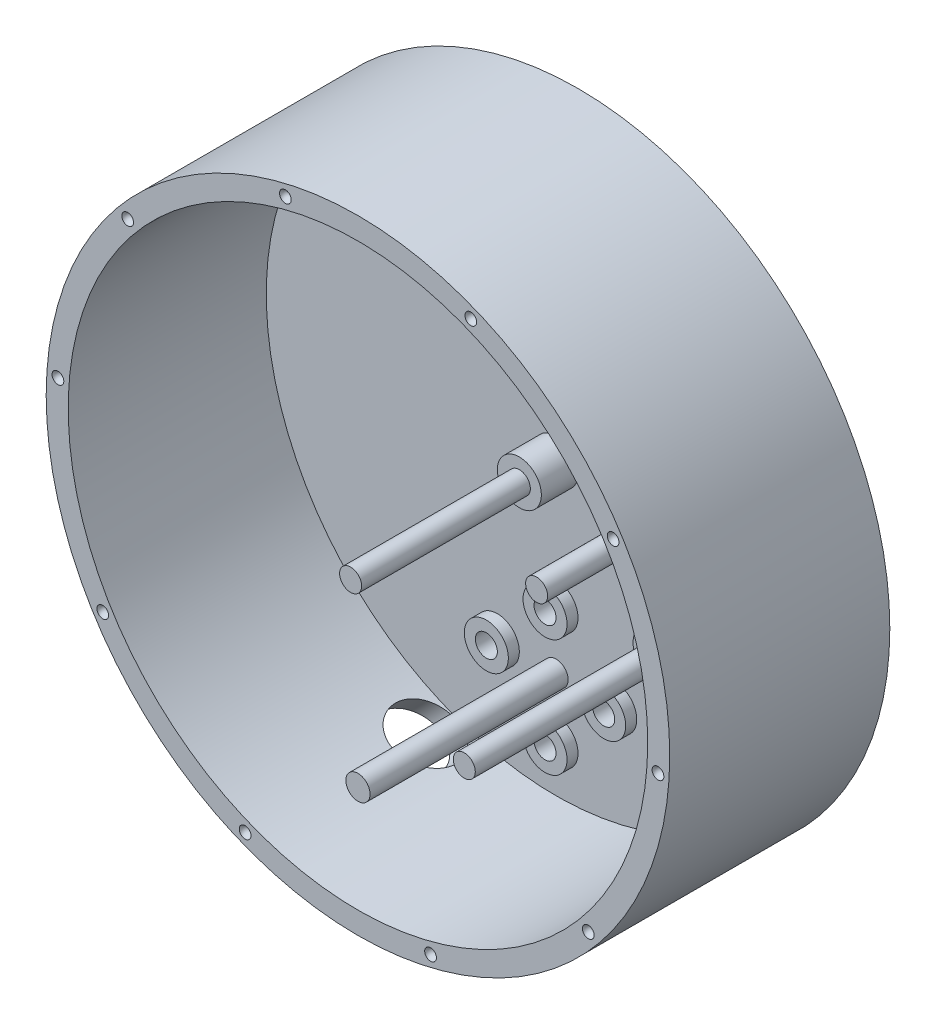
from build123d import *

# Parameters (mm, degrees)
SKETCH_1_R               = 42.5
SKETCH_1_R_2             = 39.5
EXTRUDE_1_DEPTH          = 30
EXTRUDE_3_OUTLINE_R      = 39.5
EXTRUDE_3_DEPTH          = 3
SKETCH_5_R               = 1.65
EXTRUDE_4_DEPTH          = 27
SKETCH_10_R              = 3
EXTRUDE_10_DEPTH         = 1.5
SKETCH_21_R              = 1.5
CUT_EXTRUDE_1_DEPTH      = 66.289738857
SKETCH_6_R               = 1.5
EXTRUDE_5_DEPTH          = 28
SKETCH_7_R               = 3
EXTRUDE_6_DEPTH          = 2
SKETCH_8_R               = 1.5
EXTRUDE_7_DEPTH          = 21
SKETCH_9_R               = 3
EXTRUDE_8_DEPTH          = 2
SKETCH_22_R              = 2.5
CUT_EXTRUDE_2_DEPTH      = 1
SKETCH_23_R              = 1.5
EXTRUDE_11_DEPTH         = 28
SKETCH_25_R              = 3
EXTRUDE_12_DEPTH         = 5
CUT_EXTRUDE_START        = -40.635067554
CUT_EXTRUDE_3_OUTLINE_R  = 4
CUT_EXTRUDE_3_DEPTH      = 6.841816997
PATTERN_CIRCULAR_1_COUNT = 10


# Read off the part's stored shape, not the designer's step: 凸台-拉伸3, 切除-拉伸3
with BuildPart() as part:
    # 草图1 → 凸台-拉伸1 (new body)
    with BuildSketch(Plane.XY):
        Circle(SKETCH_1_R)
        Circle(SKETCH_1_R_2, mode=Mode.SUBTRACT)
    extrude(amount=EXTRUDE_1_DEPTH)

    # 凸台-拉伸3 outline → 凸台-拉伸3 (add)
    with BuildSketch(Plane.XY):
        Circle(EXTRUDE_3_OUTLINE_R)
    extrude(amount=EXTRUDE_3_DEPTH)

    # 草图5 → 凸台-拉伸4 (add)
    with BuildSketch(Plane.XY.offset(3)):
        with Locations((0, -25)):
            Circle(SKETCH_5_R)
    extrude(amount=EXTRUDE_4_DEPTH)

    # 草图10 → 凸台-拉伸10 (add)
    with BuildSketch(Plane.XY.offset(3)):
        with Locations((8, -25)):
            Circle(SKETCH_10_R)
        with Locations((0, -17)):
            Circle(SKETCH_10_R)
        with Locations((-8, -25)):
            Circle(SKETCH_10_R)
        with Locations((0, -33)):
            Circle(SKETCH_10_R)
    extrude(amount=EXTRUDE_10_DEPTH)

    # 草图21 → 切除-拉伸1 (cut, through all)
    with BuildSketch(Plane.XY.offset(4.5)):
        with Locations((-8, -25)):
            Circle(SKETCH_21_R)
        with Locations((0, -17)):
            Circle(SKETCH_21_R)
        with Locations((8, -25)):
            Circle(SKETCH_21_R)
        with Locations((0, -33)):
            Circle(SKETCH_21_R)
    extrude(amount=-CUT_EXTRUDE_1_DEPTH, mode=Mode.SUBTRACT)

    # 草图6 → 凸台-拉伸5 (add)
    with BuildSketch(Plane.XY.offset(3)):
        with Locations((15.493440366, -14.1758)):
            Circle(SKETCH_6_R)
    extrude(amount=EXTRUDE_5_DEPTH)

    # 草图7 → 凸台-拉伸6 (add)
    with BuildSketch(Plane.XY.offset(3)):
        with Locations((15.493440366, -14.1758)):
            Circle(SKETCH_7_R)
    extrude(amount=EXTRUDE_6_DEPTH)

    # 草图8 → 凸台-拉伸7 (add)
    with BuildSketch(Plane.XY.offset(3)):
        with Locations(Location((18.354917539, 4.506329118, 0), (0, 0, 180))):
            Circle(SKETCH_8_R)
    extrude(amount=EXTRUDE_7_DEPTH)

    # 草图9 → 凸台-拉伸8 (add)
    with BuildSketch(Plane.XY.offset(3)):
        with Locations((18.354917539, 4.506329118)):
            Circle(SKETCH_9_R)
    extrude(amount=EXTRUDE_8_DEPTH)

    # 草图22 → 切除-拉伸2 (cut)
    with BuildSketch(Plane(origin=(0, 0, 0), x_dir=(-1, 0, 0), z_dir=(0, 0, -1))):
        with Locations((-8, -25)):
            Circle(SKETCH_22_R)
        with Locations((0, -17)):
            Circle(SKETCH_22_R)
        with Locations((8, -25)):
            Circle(SKETCH_22_R)
        with Locations((0, -33)):
            Circle(SKETCH_22_R)
    extrude(amount=-CUT_EXTRUDE_2_DEPTH, mode=Mode.SUBTRACT)

    # 草图23 → 凸台-拉伸11 (add)
    with BuildSketch(Plane.XY.offset(3)):
        Circle(SKETCH_23_R)
    extrude(amount=EXTRUDE_11_DEPTH)

    # 草图25 → 凸台-拉伸12 (add)
    with BuildSketch(Plane.XY.offset(3)):
        Circle(SKETCH_25_R)
    extrude(amount=EXTRUDE_12_DEPTH)

    # 切除-拉伸3 outline → 切除-拉伸3 (cut)
    with BuildSketch(Plane(origin=(0, 0, 0), x_dir=(0.707106781186546, -0.707106781186549, 0), z_dir=(0.707106781186549, 0.707106781186546, 0)).offset(CUT_EXTRUDE_START)):
        with Locations((16.451557856, -7.167019764)):
            Circle(CUT_EXTRUDE_3_OUTLINE_R)
    extrude(amount=CUT_EXTRUDE_3_DEPTH, mode=Mode.SUBTRACT)

    # 草图27 → 切除-旋转9 (revolve, cut)
    with BuildSketch(Plane.XY.offset(30)):
        with BuildLine():
            Line((-15.682372669, -38.746653887), (-15.082090462, -37.26352838))
            ThreePointArc((-15.082090462, -37.26352838), (-14.640668812, -38.305232237), (-15.682372669, -38.746653887))
        make_face()
    cut_revolve_9 = revolve(axis=Axis((-15.682372669, -38.746653887, 30), (0.3751763796445371, 0.9269534422811203, 0)), mode=Mode.SUBTRACT)

    # 阵列(圆周)1: 切除-旋转9 ×10 about axis
    pattern_circular_1_axis = Axis((0, 0, 0), (0, 0, 1))
    for i in range(1, PATTERN_CIRCULAR_1_COUNT):
        add(cut_revolve_9.rotate(pattern_circular_1_axis, i * 360 / PATTERN_CIRCULAR_1_COUNT), mode=Mode.SUBTRACT)


solid = part.part
